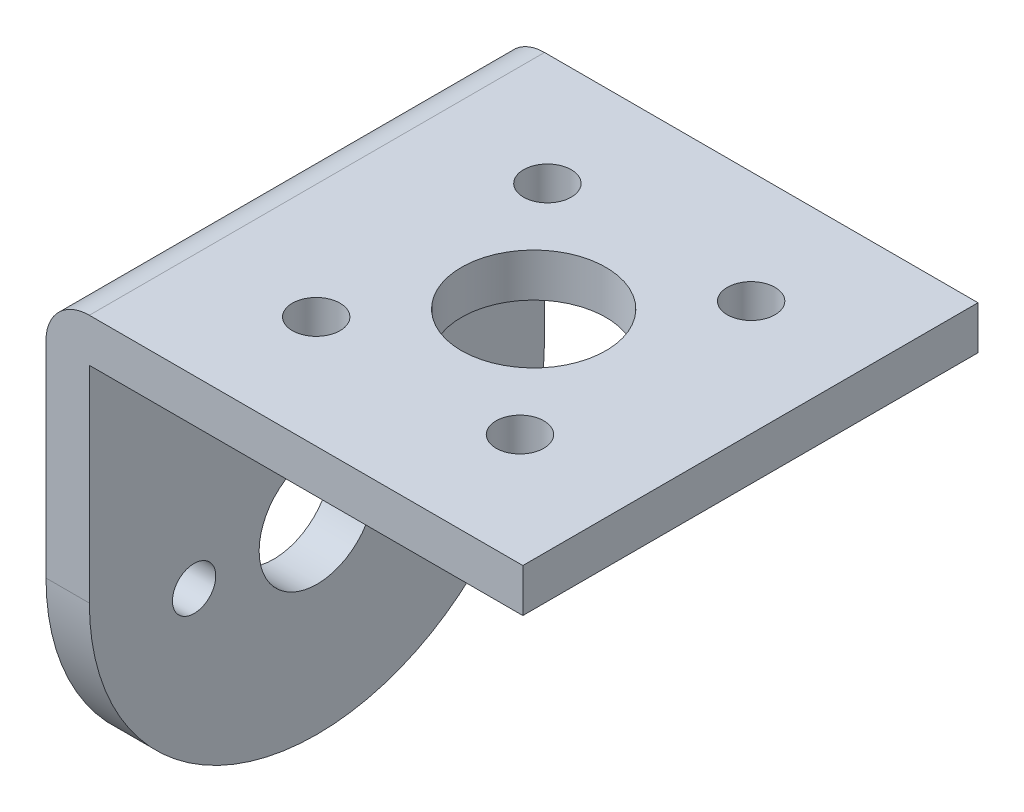
from build123d import *

# Parameters (mm, degrees)
SKETCH1_W           = 33
SKETCH1_H           = 31.5
SKETCH1_R           = 5
SKETCH1_R_2         = 1.65
BOSS_EXTRUDE1_DEPTH = 3
SKETCH2_W           = 3
SKETCH2_H           = 31.5
BOSS_EXTRUDE2_DEPTH = 30
SKETCH3_R           = 1.5
SKETCH3_R_2         = 4
CUT_EXTRUDE1_DEPTH  = 30
FILLET3_R           = 15.75
FILLET4_R           = 3


with BuildPart() as part:
    # Sketch1 → Boss-Extrude1 (new body)
    with BuildSketch(Plane(origin=(0, 0, 0), x_dir=(1, 0, 0), z_dir=(0, 1, 0))):
        with Locations((16.5, 15.75)):
            Rectangle(SKETCH1_W, SKETCH1_H)
        with Locations(Location((18, 15.75, 0), (0, 0, 270))):
            Circle(SKETCH1_R, mode=Mode.SUBTRACT)
        with Locations(Location((25.05, 23.75, 0), (0, 0, 270))):
            Circle(SKETCH1_R_2, mode=Mode.SUBTRACT)
        with Locations(Location((10.95, 23.75, 0), (0, 0, 270))):
            Circle(SKETCH1_R_2, mode=Mode.SUBTRACT)
        with Locations(Location((25.05, 7.75, 0), (0, 0, 90))):
            Circle(SKETCH1_R_2, mode=Mode.SUBTRACT)
        with Locations(Location((10.95, 7.75, 0), (0, 0, 90))):
            Circle(SKETCH1_R_2, mode=Mode.SUBTRACT)
    extrude(amount=BOSS_EXTRUDE1_DEPTH)

    # Sketch2 → Boss-Extrude2 (add)
    with BuildSketch(Plane.XZ):
        with Locations((1.5, -15.75)):
            Rectangle(SKETCH2_W, SKETCH2_H)
    extrude(amount=BOSS_EXTRUDE2_DEPTH)

    # Sketch3 → Cut-Extrude1 (cut)
    with BuildSketch(Plane.ZY):
        with Locations((-24.25, -17)):
            Circle(SKETCH3_R)
        with Locations((-7.25, -17)):
            Circle(SKETCH3_R)
        with Locations((-15.75, -17)):
            Circle(SKETCH3_R_2)
    extrude(amount=-CUT_EXTRUDE1_DEPTH, mode=Mode.SUBTRACT)

    # Fillet3
    fillet3_edges = [part.edges().sort_by_distance(p)[0] for p in [
        (1.5, -30, 0),
        (1.5, -30, -31.5),
    ]]
    fillet(fillet3_edges, radius=FILLET3_R - 0.0001)  # a hair under: the kernel refuses the full size

    # Fillet4
    fillet4_edges = [part.edges().sort_by_distance(p)[0] for p in [
        (0, 3, -15.75),
    ]]
    fillet(fillet4_edges, radius=FILLET4_R)


solid = part.part
